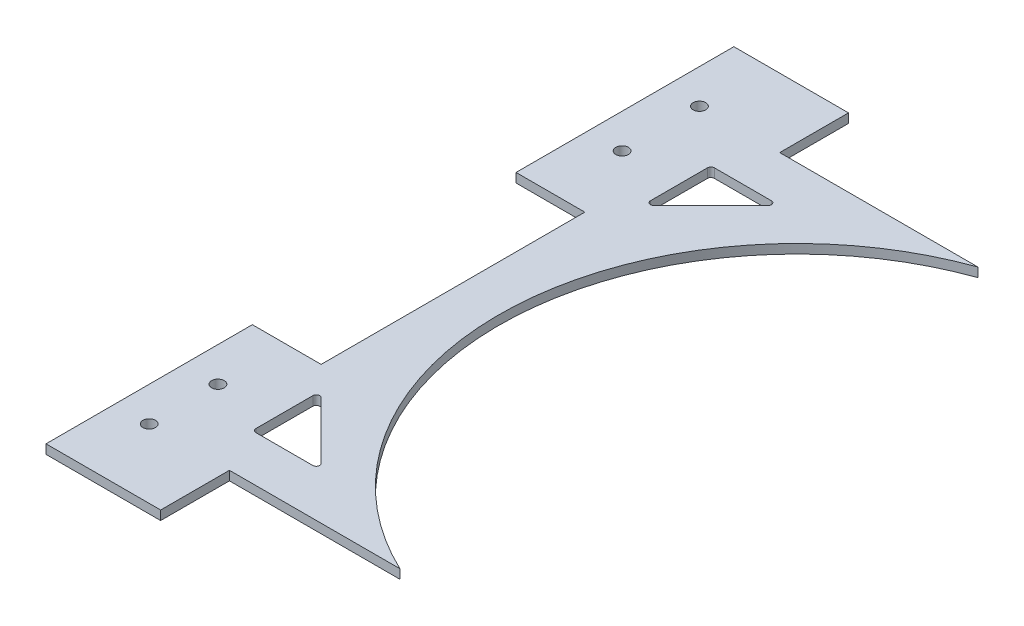
from build123d import *

# Parameters (mm, degrees)
SKETCH_1_W          = 360
SKETCH_1_H          = 300
EXTRUDE_1_DEPTH     = 4
SKETCH_2_W          = 260
SKETCH_2_H          = 30
CUT_EXTRUDE_1_DEPTH = 469.632051827
SKETCH_3_W          = 30
SKETCH_3_H          = 115
CUT_EXTRUDE_2_DEPTH = 469.632051827
CUT_EXTRUDE_3_DEPTH = 469.632051827
SKETCH_5_R          = 2.75
CUT_EXTRUDE_4_DEPTH = 330.611201771
CUT_EXTRUDE_5_DEPTH = 330.611201771


with BuildPart() as part:
    # 草图1 → 凸台-拉伸1 (new body)
    with BuildSketch(Plane(origin=(0, 0, 0), x_dir=(1, 0, 0), z_dir=(0, 1, 0))):
        with Locations((180, -150)):
            Rectangle(SKETCH_1_W, SKETCH_1_H)
    extrude(amount=EXTRUDE_1_DEPTH)

    # 草图2 → 切除-拉伸1 (cut, through all)
    with BuildSketch(Plane(origin=(0, 4, 0), x_dir=(1, 0, 0), z_dir=(0, 1, 0))):
        with Locations((180, -15)):
            Rectangle(SKETCH_2_W, SKETCH_2_H)
        with Locations((180, -285)):
            Rectangle(SKETCH_2_W, SKETCH_2_H)
    extrude(amount=-CUT_EXTRUDE_1_DEPTH, mode=Mode.SUBTRACT)

    # 草图3 → 切除-拉伸2 (cut, through all)
    with BuildSketch(Plane(origin=(0, 4, 0), x_dir=(1, 0, 0), z_dir=(0, 1, 0))):
        with Locations((15, -152.5)):
            Rectangle(SKETCH_3_W, SKETCH_3_H)
        with Locations((345, -152.5)):
            Rectangle(SKETCH_3_W, SKETCH_3_H)
    extrude(amount=-CUT_EXTRUDE_2_DEPTH, mode=Mode.SUBTRACT)

    # 草图4 → 切除-拉伸3 (cut, through all)
    with BuildSketch(Plane(origin=(0, 4, 0), x_dir=(1, 0, 0), z_dir=(0, 1, 0))):
        with BuildLine():
            ThreePointArc((136.482762036, -30), (50.165020973, -145.951853607), (124.378511347, -270))
            Line((124.378511347, -270), (235.621488653, -270))
            ThreePointArc((235.621488653, -270), (309.834979027, -145.951853607), (223.517237964, -30))
            Line((223.517237964, -30), (136.482762036, -30))
        make_face()
    extrude(amount=-CUT_EXTRUDE_3_DEPTH, mode=Mode.SUBTRACT)


with BuildPart() as cut_extrude_3_kept_piece:
    # of the separate pieces the step leaves, the one the design keeps (cut_extrude_3_pieces_kept)
    add(part.part.solids().sort_by_distance((0, 0, 0))[0])

    # 草图5 → 切除-拉伸4 (cut, through all)
    with BuildSketch(Plane(origin=(0, 4, 0), x_dir=(1, 0, 0), z_dir=(0, 1, 0))):
        with Locations((15, -270)):
            Circle(SKETCH_5_R)
        with Locations((15, -30)):
            Circle(SKETCH_5_R)
        with Locations((15, -63.744001195)):
            Circle(SKETCH_5_R)
        with Locations((15, -240)):
            Circle(SKETCH_5_R)
    extrude(amount=-CUT_EXTRUDE_4_DEPTH, mode=Mode.SUBTRACT)

    # 草图6 → 切除-拉伸5 (cut, through all)
    with BuildSketch(Plane(origin=(0, 4, 0), x_dir=(1, 0, 0), z_dir=(0, 1, 0))):
        with BuildLine():
            Line((66.378679656, -50), (50, -50))
            Line((50, -50), (41.5, -50))
            ThreePointArc((41.5, -50), (40.439339828, -50.439339828), (40, -51.5))
            Line((40, -51.5), (40, -76.378679656))
            ThreePointArc((40, -76.378679656), (40.925974851, -77.764498955), (42.560660172, -77.439339828))
            Line((42.560660172, -77.439339828), (67.439339828, -52.560660172))
            ThreePointArc((67.439339828, -52.560660172), (67.764498955, -50.925974851), (66.378679656, -50))
        make_face()
    cut_extrude_5 = extrude(amount=-CUT_EXTRUDE_5_DEPTH, mode=Mode.SUBTRACT)

    # 镜向1: 切除-拉伸5 across plane
    add(cut_extrude_5.mirror(Plane.XY.offset(150)), mode=Mode.SUBTRACT)


solid = cut_extrude_3_kept_piece.part
